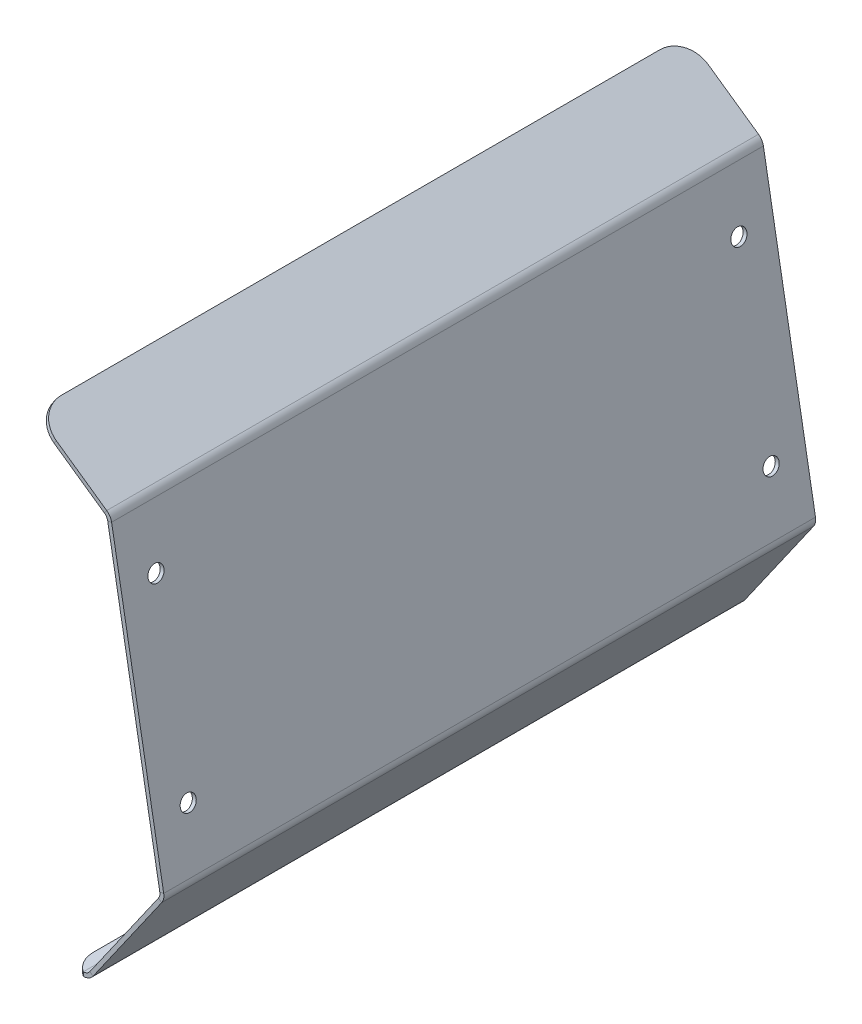
from build123d import *

# Parameters (mm, degrees)
BASE_FLANGE1_DEPTH = 246
FILLET1_START      = -79
FILLET1_DEPTH      = 4
FILLET1_START_2    = 148
FILLET1_2_DEPTH    = 3
SKETCH6_R          = 3
CUT_EXTRUDE1_DEPTH = 1.5


with BuildPart() as part:
    # Base-Flange1: sheet metal written as solids
    # Sketch1 → Base-Flange1 (new body)
    with BuildSketch(Plane.XY):
        with BuildLine():
            Line((135.953063945, -76.256345678), (140.443766564, -76.256345678))
            ThreePointArc((140.443766564, -76.256345678), (141.829012404, -75.917378177), (142.901222697, -74.977074987))
            Line((142.901222697, -74.977074987), (168.801582917, -37.987527165))
            ThreePointArc((168.801582917, -37.987527165), (169.273014805, -36.916116698), (169.298550043, -35.745853323))
            Line((169.298550043, -35.745853323), (169.167035978, -35))
            Line((169.167035978, -35), (149.639554036, 75.745853323))
            ThreePointArc((149.639554036, 75.745853323), (149.215305114, 76.836807615), (148.405860086, 77.682364923))
            Line((148.405860086, 77.682364923), (121.208107966, 96.72643598))
            Line((121.208107966, 96.72643598), (122.06847262, 97.955164046))
            Line((122.06847262, 97.955164046), (149.266224741, 78.911092989))
            ThreePointArc((149.266224741, 78.911092989), (150.480392283, 77.642757028), (151.116765666, 76.00632559))
            Line((151.116765666, 76.00632559), (170.644247608, -34.739527733))
            Line((170.644247608, -34.739527733), (170.775761672, -35.485381057))
            ThreePointArc((170.775761672, -35.485381057), (170.737458816, -37.240776119), (170.030310983, -38.84789182))
            Line((170.030310983, -38.84789182), (144.129950763, -75.837439642))
            ThreePointArc((144.129950763, -75.837439642), (142.521635324, -77.247894427), (140.443766564, -77.756345678))
            Line((140.443766564, -77.756345678), (135.953063945, -77.756345678))
            Line((135.953063945, -77.756345678), (135.953063945, -76.256345678))
        make_face()
    extrude(amount=BASE_FLANGE1_DEPTH)

    # Fillet1: read off the stored shape, not the designer's step
    # Fillet1 outline → Fillet1 (cut)
    with BuildSketch(Plane(origin=(0, 0, 0), x_dir=(1, 0, 0), z_dir=(0, 1, 0)).offset(FILLET1_START)):
        with BuildLine():
            Line((135.953063945, 0), (135.953063945, -8.345516304))
            ThreePointArc((135.953063945, -8.345516304), (137.147015631, -3.607002497), (140.443766564, 0))
            Line((140.443766564, 0), (135.953063945, 0))
        make_face()
        with BuildLine():
            ThreePointArc((140.443766564, -246), (137.147015631, -242.392997503), (135.953063945, -237.654483696))
            Line((135.953063945, -237.654483696), (135.953063945, -246))
            Line((135.953063945, -246), (140.443766564, -246))
        make_face()
    extrude(amount=FILLET1_DEPTH, mode=Mode.SUBTRACT)

    # Fillet1 2 outline → Fillet1 2 (cut)
    with BuildSketch(Plane(origin=(0, 0, 0), x_dir=(0.819152044288989, -0.5735764363510502, 0), z_dir=(0.57357643635105, 0.819152044288989, 0)).offset(FILLET1_START_2)):
        with BuildLine():
            Line((43.807864974, 0), (43.807864974, -10))
            ThreePointArc((43.807864974, -10), (46.736797162, -2.928932188), (53.807864974, 0))
            Line((53.807864974, 0), (43.807864974, 0))
        make_face()
        with BuildLine():
            ThreePointArc((53.807864974, -246), (46.736797162, -243.071067812), (43.807864974, -236))
            Line((43.807864974, -236), (43.807864974, -246))
            Line((43.807864974, -246), (53.807864974, -246))
        make_face()
    extrude(amount=FILLET1_2_DEPTH, mode=Mode.SUBTRACT)

    # Sketch6 → Cut-Extrude1 (cut)
    with BuildSketch(Plane(origin=(159.557884805, 28.134360076, 0), x_dir=(0, 0, -1), z_dir=(0.984807753012208, 0.17364817766693147, 0))):
        with Locations(Location((-233, 27.004644779, 0), (0, 0, 90))):
            Circle(SKETCH6_R)
        with Locations(Location((-233, -42.995355221, 0), (0, 0, 90))):
            Circle(SKETCH6_R)
        with Locations(Location((-13, -42.995355221, 0), (0, 0, 90))):
            Circle(SKETCH6_R)
        with Locations(Location((-13, 27.004644779, 0), (0, 0, 90))):
            Circle(SKETCH6_R)
    extrude(amount=-CUT_EXTRUDE1_DEPTH, mode=Mode.SUBTRACT)


solid = part.part
